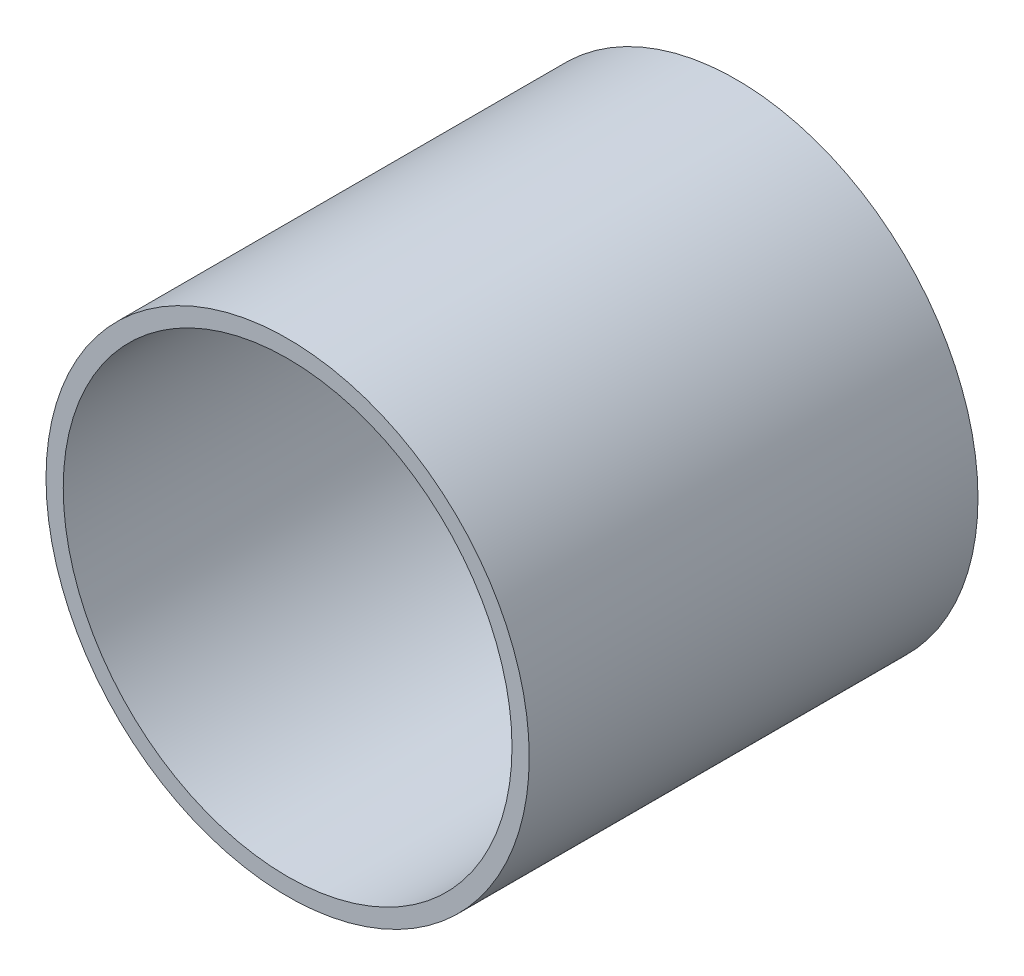
from build123d import *

# Parameters (mm, degrees)
SKIZZE1_R                       = 28.4
SKIZZE1_R_2                     = 26.375
AUFSATZ_LINEAR_AUSTRAGEN1_DEPTH = 52.75
GEWINDE1_PITCH                  = 2
SKIZZE4_R                       = 27.321734871
SKIZZE4_R_2                     = 25.475
AUFSATZ_LINEAR_AUSTRAGEN2_DEPTH = 1
FASE1_SIZE                      = 1


with BuildPart() as part:
    # Skizze1 → Aufsatz-Linear austragen1 (new body)
    with BuildSketch(Plane.XY):
        Circle(SKIZZE1_R)
        Circle(SKIZZE1_R_2, mode=Mode.SUBTRACT)
    extrude(amount=AUFSATZ_LINEAR_AUSTRAGEN1_DEPTH)

    # Gewinde1: the profile of Gewindeprofil1 profile screwed along a right-hand helix of 5 turns, 10 arcs to a turn; built about Z, then put on its axis
    gewinde1_z = Axis((0, 0, 0), (0, 0, 1))
    gewinde1_corners = [(26.3747, 0, -0.000173205), (27.051582344, 0, 0.390624998), (27.051582344, 0, 0.546874998), (26.3747, 0, 0.937673202)]
    with BuildLine(mode=Mode.PRIVATE) as gewinde1_profile:
        Line(gewinde1_corners[0], gewinde1_corners[1])
        Line(gewinde1_corners[1], gewinde1_corners[2])
        Line(gewinde1_corners[2], gewinde1_corners[3])
        Line(gewinde1_corners[3], gewinde1_corners[0])
    gewinde1_cap = Face(gewinde1_profile.wire())
    gewinde1_turn_angles = [0, 18, 36, 54, 72, 90, 108, 126, 144, 162, 180, 198, 216, 234, 252, 270, 288, 306, 324, 342, 360]
    gewinde1_turn_weights = [1, 0.9510565162951535, 1, 0.9510565162951535, 1, 0.9510565162951535, 1, 0.9510565162951535, 1, 0.9510565162951535, 1, 0.9510565162951535, 1, 0.9510565162951535, 1, 0.9510565162951535, 1, 0.9510565162951535, 1, 0.9510565162951535, 1]
    gewinde1_turn_rails = [Edge.make_bspline([Vector(p[0], p[1], 0).rotate(gewinde1_z, gewinde1_turn_angles[k]) / gewinde1_turn_weights[k] + Vector(0, 0, p[2] + GEWINDE1_PITCH * gewinde1_turn_angles[k] / 360) for k in range(21)], [0, 0, 0, 1, 1, 2, 2, 3, 3, 4, 4, 5, 5, 6, 6, 7, 7, 8, 8, 9, 9, 10, 10, 10], 2, gewinde1_turn_weights) for p in gewinde1_corners]
    gewinde1_turn_sides = [Face.make_surface_from_curves(gewinde1_turn_rails[p[0]], gewinde1_turn_rails[p[1]]) for p in [(0, 1), (1, 2), (2, 3), (3, 0)]]
    gewinde1 = Plane(origin=(0, 0, -1), x_dir=(1, 0, 0), z_dir=(0, 0, 1)) * Solid(Shell([*[p.moved(Location((0, 0, GEWINDE1_PITCH * i))) for i in range(5) for p in gewinde1_turn_sides], gewinde1_cap, gewinde1_cap.rotate(gewinde1_z, 1800).moved(Location((0, 0, GEWINDE1_PITCH * 1800 / 360)))]))
    add(gewinde1, mode=Mode.SUBTRACT)

    # Skizze4 → Aufsatz-Linear austragen2 (add)
    with BuildSketch(Plane(origin=(0, 0, 9.3), x_dir=(-1, 0, 0), z_dir=(0, 0, -1))):
        Circle(SKIZZE4_R)
        Circle(SKIZZE4_R_2, mode=Mode.SUBTRACT)
    extrude(amount=-AUFSATZ_LINEAR_AUSTRAGEN2_DEPTH)

    # Fase1
    # the kernel refuses this chamfer: 1 mm, written as the material it adds along each edge
    with BuildSketch(Plane(origin=(0, 0, 10.3), x_dir=(1, 0, 0), z_dir=(0, 1, 0))) as fase1_piece_1_section:
        Polygon((26.375, -FASE1_SIZE), (26.375 - FASE1_SIZE, 0), (26.375, 0), align=None)
    fase1_piece_1 = revolve(axis=Axis((0, 0, 10.3), (0, 0, -1)), mode=Mode.PRIVATE)
    fase1_piece_1 = fase1_piece_1 - Plane(origin=(0, 0, 10.832640303), x_dir=(-1, 0, 0), z_dir=(0, 0, -1)) * Cylinder(25.475, 106, mode=Mode.PRIVATE)
    add(fase1_piece_1)


solid = part.part
